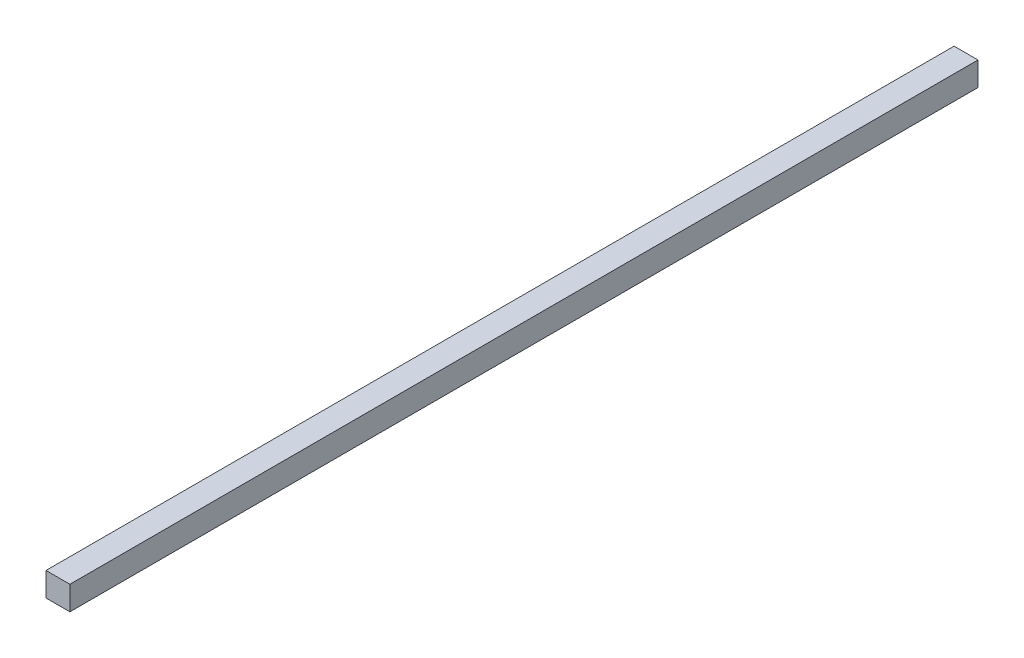
from build123d import *

# Parameters (mm, degrees)
SKETCH1_W           = 456
SKETCH1_H           = 12
BOSS_EXTRUDE1_DEPTH = 12


with BuildPart() as part:
    # Sketch1 → Boss-Extrude1 (new body)
    with BuildSketch(Plane(origin=(0, 0, 0), x_dir=(0, 0, -1), z_dir=(1, 0, 0))):
        with Locations((228, 6)):
            Rectangle(SKETCH1_W, SKETCH1_H)
    extrude(amount=BOSS_EXTRUDE1_DEPTH)


solid = part.part
